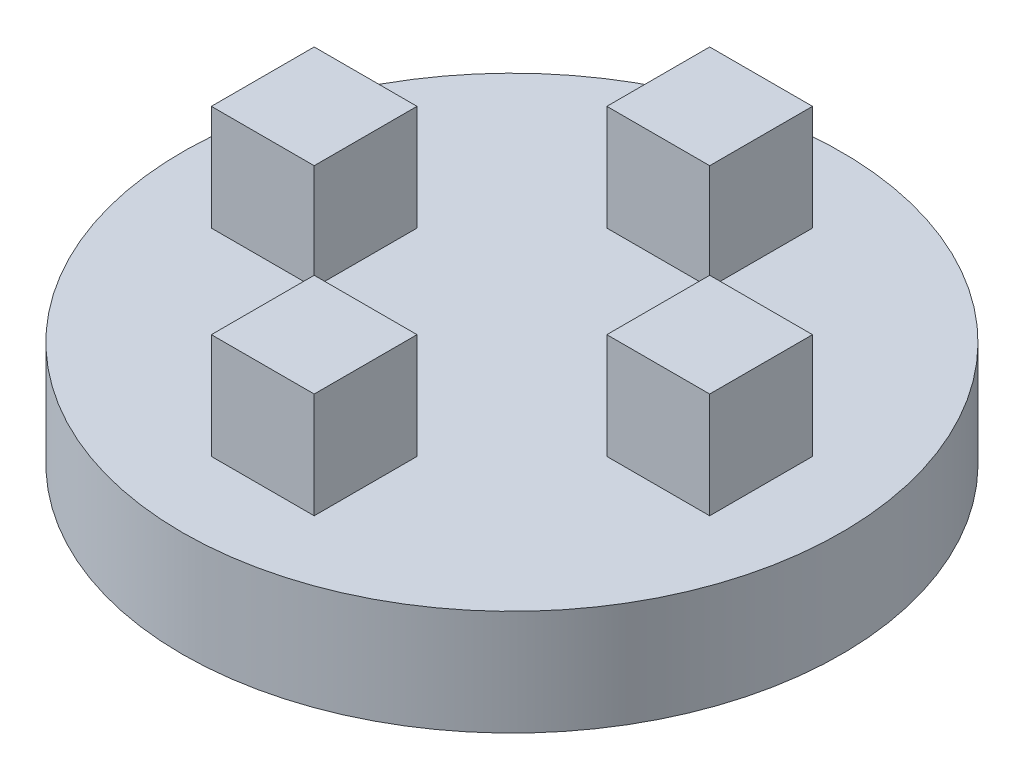
from build123d import *

# Parameters (mm, degrees)
SKETCH1_R           = 12.5
BOSS_EXTRUDE1_DEPTH = 2
SKETCH2_W           = 3.9
SKETCH2_H           = 3.9
BOSS_EXTRUDE3_DEPTH = 4
SKETCH3_R           = 5
BOSS_EXTRUDE4_DEPTH = 1
BOSS_EXTRUDE5_DEPTH = 5


with BuildPart() as part:
    # Sketch1 → Boss-Extrude1 (new, symmetric)
    with BuildSketch(Plane(origin=(0, 0, 0), x_dir=(1, 0, 0), z_dir=(0, 1, 0))):
        Circle(SKETCH1_R)
    extrude(amount=BOSS_EXTRUDE1_DEPTH, both=True)

    # Sketch2 → Boss-Extrude3 (add)
    with BuildSketch(Plane(origin=(0, 2, 0), x_dir=(1, 0, 0), z_dir=(0, 1, 0))):
        with Locations((0, 7.5)):
            Rectangle(SKETCH2_W, SKETCH2_H)
        with Locations((7.5, 0)):
            Rectangle(SKETCH2_W, SKETCH2_H)
        with Locations((0, -7.5)):
            Rectangle(SKETCH2_W, SKETCH2_H)
        with Locations((-7.5, 0)):
            Rectangle(SKETCH2_W, SKETCH2_H)
    extrude(amount=BOSS_EXTRUDE3_DEPTH)

    # Sketch3 → Boss-Extrude4 (add)
    with BuildSketch(Plane.XZ.offset(2)):
        Circle(SKETCH3_R)
    extrude(amount=BOSS_EXTRUDE4_DEPTH)

    # Sketch4 → Boss-Extrude5 (add)
    with BuildSketch(Plane.XZ.offset(3)):
        Polygon((0, -3.7), (3.204293994, -1.85), (3.204293994, 1.85), (0, 3.7), (-3.204293994, 1.85), (-3.204293994, -1.85), align=None)
    extrude(amount=BOSS_EXTRUDE5_DEPTH)


solid = part.part
